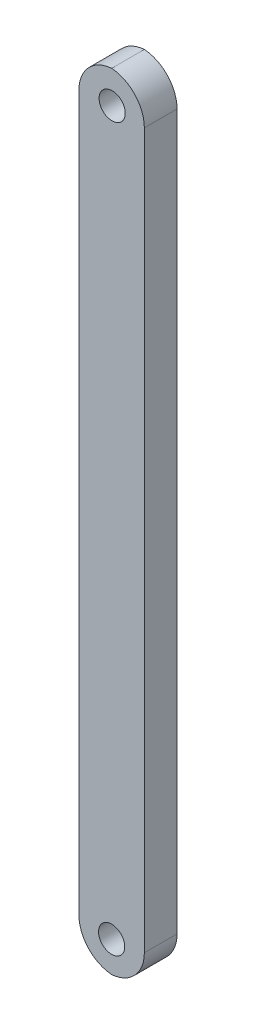
from build123d import *

# Parameters (mm, degrees)
SKETCH7_W           = 50
SKETCH7_H           = 600
BOSS_EXTRUDE1_DEPTH = 12.5
FILLET1_R           = 27
SKETCH8_R           = 10
CUT_EXTRUDE1_DEPTH  = 375.030958071
SKETCH9_R           = 10
CUT_EXTRUDE2_DEPTH  = 375.030958071


with BuildPart() as part:
    # Sketch7 → Boss-Extrude1 (new, symmetric)
    with BuildSketch(Plane.XY):
        with Locations((12.3, -71.4)):
            Rectangle(SKETCH7_W, SKETCH7_H)
    extrude(amount=BOSS_EXTRUDE1_DEPTH, both=True)

    # Fillet1
    # the kernel refuses this fillet: 27 mm, written as the material it takes off along each edge
    with BuildSketch(Plane(origin=(37.3, -371.4, -80), x_dir=(-1, 0, 0), z_dir=(0, 0, 1)), Plane(origin=(-12.7, -371.4, 80), x_dir=(1, 0, 0), z_dir=(0, 0, -1))) as fillet1_piece_1:
        with BuildLine():
            CenterArc((FILLET1_R, -FILLET1_R), FILLET1_R, 90, 90)
            Line((0, -FILLET1_R), (0, 0))
            Line((0, 0), (FILLET1_R, 0))
        make_face()
    extrude(amount=160, mode=Mode.SUBTRACT)
    with BuildSketch(Plane(origin=(-12.7, 228.6, 80), x_dir=(1, 0, 0), z_dir=(0, 0, -1)), Plane(origin=(37.3, 228.6, -80), x_dir=(-1, 0, 0), z_dir=(0, 0, 1))) as fillet1_piece_2:
        with BuildLine():
            CenterArc((FILLET1_R, FILLET1_R), FILLET1_R, 180, 90)
            Line((0, FILLET1_R), (0, 0))
            Line((0, 0), (FILLET1_R, 0))
        make_face()
    extrude(amount=160, mode=Mode.SUBTRACT)

    # Sketch8 → Cut-Extrude1 (cut, through all)
    with BuildSketch(Plane.XY.offset(12.5)):
        with Locations((12.7, 203.901138173)):
            Circle(SKETCH8_R)
    extrude(amount=-CUT_EXTRUDE1_DEPTH, mode=Mode.SUBTRACT)

    # Sketch9 → Cut-Extrude2 (cut, through all)
    with BuildSketch(Plane.XY.offset(12.5)):
        with Locations((12.3, -347.928194148)):
            Circle(SKETCH9_R)
    extrude(amount=-CUT_EXTRUDE2_DEPTH, mode=Mode.SUBTRACT)


solid = part.part
